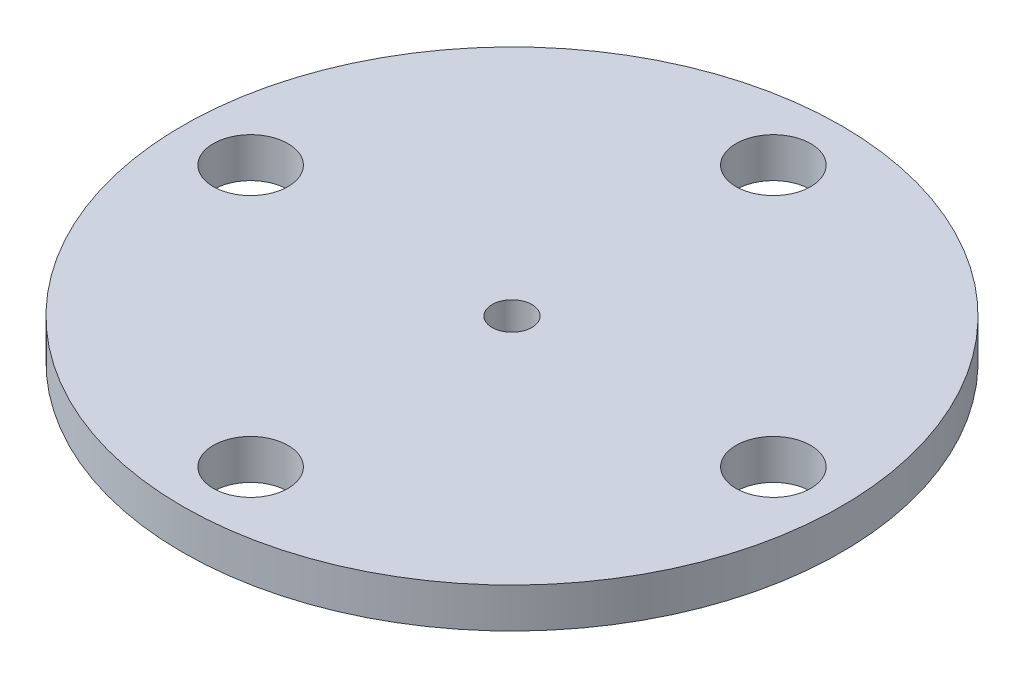
from build123d import *

# Parameters (mm, degrees)
SKETCH1_R           = 66.2
SKETCH1_R_2         = 4
BOSS_EXTRUDE2_DEPTH = 8
SKETCH2_R           = 7.5
CUT_EXTRUDE1_DEPTH  = 94.962120027


with BuildPart() as part:
    # Sketch1 → Boss-Extrude2 (new body)
    with BuildSketch(Plane(origin=(0, 0, 0), x_dir=(1, 0, 0), z_dir=(0, 1, 0))):
        Circle(SKETCH1_R)
        Circle(SKETCH1_R_2, mode=Mode.SUBTRACT)
    extrude(amount=BOSS_EXTRUDE2_DEPTH)

    # Sketch2 → Cut-Extrude1 (cut, through all)
    with BuildSketch(Plane(origin=(0, 8, 0), x_dir=(1, 0, 0), z_dir=(0, 1, 0))):
        with Locations((0, -52.5)):
            Circle(SKETCH2_R)
        with Locations((-52.5, 0)):
            Circle(SKETCH2_R)
        with Locations((0, 52.5)):
            Circle(SKETCH2_R)
        with Locations((52.5, 0)):
            Circle(SKETCH2_R)
    extrude(amount=-CUT_EXTRUDE1_DEPTH, mode=Mode.SUBTRACT)


solid = part.part
